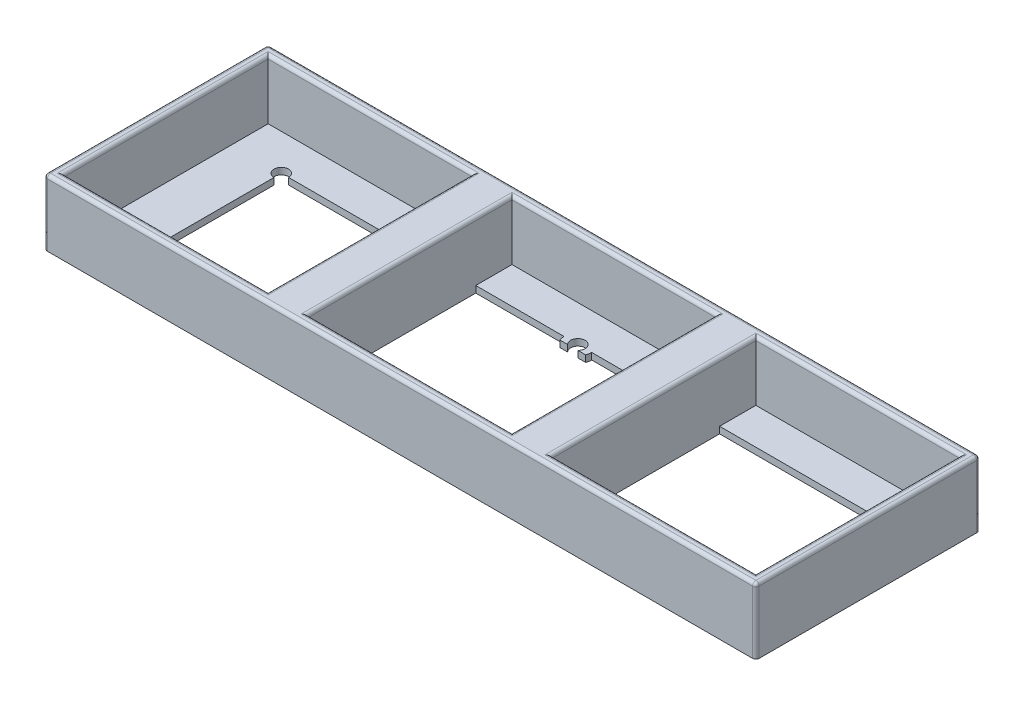
from build123d import *
from build123d.topology import SkipClean

# Parameters (mm, degrees)
EXTRUDE_1_DEPTH   = 1
EXTRUDE_1_2_DEPTH = 1
EXTRUDE_1_3_DEPTH = 1
EXTRUDE_1_4_DEPTH = 1
SKETCH_1_3_W      = 108
SKETCH_1_3_H      = 34
SKETCH_1_3_W_2    = 105
SKETCH_1_3_H_2    = 31
SKETCH_1_3_W_3    = 6
SKETCH_1_3_H_3    = 20
SKETCH_1_3_H_4    = 5.5
EXTRUDE_2_DEPTH   = 10
FILLET_1_R        = 0.5
FILLET_2_R        = 0.5
EXTRUDE_3_DEPTH   = 1
CHAMFER_1_SIZE    = 1


with BuildPart() as part:
    # 草图1 → 凸台-拉伸1 (new body)
    with BuildSketch(Plane(origin=(0, 0, 0), x_dir=(1, 0, 0), z_dir=(0, 1, 0))):
        with BuildLine():
            Line((-21.5, 10), (-21.5, 15.5))
            Line((-21.5, 15.5), (-52.5, 15.5))
            Line((-52.5, 15.5), (-52.5, -15.5))
            Line((-52.5, -15.5), (-21.5, -15.5))
            Line((-21.5, -15.5), (-21.5, -10))
            Line((-21.5, -10), (-43.9, -10))
            ThreePointArc((-43.9, -10), (-45.777817459, -10.777817459), (-45, -8.9))
            Line((-45, -8.9), (-45, 8.9))
            ThreePointArc((-45, 8.9), (-45.777817459, 10.777817459), (-43.9, 10))
            Line((-43.9, 10), (-21.5, 10))
        make_face()
    extrude(amount=EXTRUDE_1_DEPTH)


with BuildPart() as body_2:
    # 草图1 → Extrude 1 2 (new body)
    with BuildSketch(Plane(origin=(0, 0, 0), x_dir=(1, 0, 0), z_dir=(0, 1, 0))):
        with BuildLine():
            Line((-1.1, -10), (-15.5, -10))
            Line((-15.5, -10), (-15.5, -15.5))
            Line((-15.5, -15.5), (15.5, -15.5))
            Line((15.5, -15.5), (15.5, -10))
            Line((15.5, -10), (1.1, -10))
            ThreePointArc((1.1, -10), (0, -11.1), (-1.1, -10))
        make_face()
    extrude(amount=EXTRUDE_1_2_DEPTH)


with BuildPart() as body_3:
    # 草图1 → Extrude 1 3 (new body)
    with BuildSketch(Plane(origin=(0, 0, 0), x_dir=(1, 0, 0), z_dir=(0, 1, 0))):
        with BuildLine():
            Line((15.5, 15.5), (-15.5, 15.5))
            Line((-15.5, 15.5), (-15.5, 10))
            Line((-15.5, 10), (-1.1, 10))
            ThreePointArc((-1.1, 10), (0, 11.1), (1.1, 10))
            Line((1.1, 10), (15.5, 10))
            Line((15.5, 10), (15.5, 15.5))
        make_face()
    extrude(amount=EXTRUDE_1_3_DEPTH)


with BuildPart() as body_4:
    # 草图1 → Extrude 1 4 (new body)
    with BuildSketch(Plane(origin=(0, 0, 0), x_dir=(1, 0, 0), z_dir=(0, 1, 0))):
        with BuildLine():
            Line((52.5, 15.5), (21.5, 15.5))
            Line((21.5, 15.5), (21.5, 10))
            Line((21.5, 10), (43.9, 10))
            ThreePointArc((43.9, 10), (45, 11.1), (46.1, 10))
            ThreePointArc((46.1, 10), (45.777817459, 9.222182541), (45, 8.9))
            Line((45, 8.9), (45, -8.9))
            ThreePointArc((45, -8.9), (45.777817459, -9.222182541), (46.1, -10))
            ThreePointArc((46.1, -10), (45, -11.1), (43.9, -10))
            Line((43.9, -10), (21.5, -10))
            Line((21.5, -10), (21.5, -15.5))
            Line((21.5, -15.5), (52.5, -15.5))
            Line((52.5, -15.5), (52.5, 15.5))
        make_face()
    extrude(amount=EXTRUDE_1_4_DEPTH)

    # 草图1<3> → 凸台-拉伸2 (add)
    # profile 1 of 7: a face of its own
    with BuildSketch(Plane(origin=(0, 0, 0), x_dir=(1, 0, 0), z_dir=(0, 1, 0))):
        Rectangle(SKETCH_1_3_W, SKETCH_1_3_H)
        Rectangle(SKETCH_1_3_W_2, SKETCH_1_3_H_2, mode=Mode.SUBTRACT)
    # profile 2 of 7: a face of its own
    with BuildSketch(Plane(origin=(0, 0, 0), x_dir=(1, 0, 0), z_dir=(0, 1, 0))):
        with Locations((-18.5, 0)):
            Rectangle(SKETCH_1_3_W_3, SKETCH_1_3_H_3)
    # profile 3 of 7: a face of its own
    with BuildSketch(Plane(origin=(0, 0, 0), x_dir=(1, 0, 0), z_dir=(0, 1, 0))):
        with Locations((18.5, 0)):
            Rectangle(SKETCH_1_3_W_3, SKETCH_1_3_H_3)
    # profile 4 of 7: a face of its own
    with BuildSketch(Plane(origin=(0, 0, 0), x_dir=(1, 0, 0), z_dir=(0, 1, 0))):
        with Locations((-18.5, 12.75)):
            Rectangle(SKETCH_1_3_W_3, SKETCH_1_3_H_4)
    # profile 5 of 7: a face of its own
    with BuildSketch(Plane(origin=(0, 0, 0), x_dir=(1, 0, 0), z_dir=(0, 1, 0))):
        with Locations((-18.5, -12.75)):
            Rectangle(SKETCH_1_3_W_3, SKETCH_1_3_H_4)
    # profile 6 of 7: a face of its own
    with BuildSketch(Plane(origin=(0, 0, 0), x_dir=(1, 0, 0), z_dir=(0, 1, 0))):
        with Locations((18.5, 12.75)):
            Rectangle(SKETCH_1_3_W_3, SKETCH_1_3_H_4)
    # profile 7 of 7: a face of its own
    with BuildSketch(Plane(origin=(0, 0, 0), x_dir=(1, 0, 0), z_dir=(0, 1, 0))):
        with Locations((18.5, -12.75)):
            Rectangle(SKETCH_1_3_W_3, SKETCH_1_3_H_4)
    extrude(amount=EXTRUDE_2_DEPTH)

    # 圆角1
    fillet_1_edges = [body_4.edges().sort_by_distance(p)[0] for p in [
        (0, 10, -17),
        (54, 5, -17),
        (-54, 5, -17),
        (-54, 5, 17),
        (54, 10, 0),
        (54, 5, 17),
        (-54, 10, 0),
        (0, 10, 17),
    ]]
    fillet(fillet_1_edges, radius=FILLET_1_R)

    # 圆角2
    fillet_2_edges = [body_4.edges().sort_by_distance(p)[0] for p in [
        (21.5, 10, 0),
        (-37, 10, 15.5),
        (37, 10, 15.5),
        (-15.5, 10, 0),
        (-52.5, 10, 0),
        (0, 10, 15.5),
        (0, 10, -15.5),
        (15.5, 10, 0),
        (37, 10, -15.5),
        (52.5, 10, 0),
        (-37, 10, -15.5),
        (-21.5, 10, 0),
    ]]
    fillet(fillet_2_edges, radius=FILLET_2_R)


    with SkipClean():  # the faces are left unmerged after this step: merging them gives an invalid solid
        add(body_2.part)  # 凸台-拉伸3 merges body 2

        add(body_3.part)  # 凸台-拉伸3 merges body 3
        # 草图2 → 凸台-拉伸3 (add)
        with BuildSketch(Plane(origin=(0, 0, 0), x_dir=(1, 0, 0), z_dir=(0, 1, 0))):
            with BuildLine():
                ThreePointArc((2.1, 10), (1.940147018, 9.196364792), (1.48492424, 8.51507576))
                Line((1.48492424, 8.51507576), (0.777817459, 9.222182541))
                ThreePointArc((0.777817459, 9.222182541), (1.016267486, 9.579048224), (1.1, 10))
                Line((1.1, 10), (2.1, 10))
            make_face()
            with BuildLine():
                Line((-0.777817459, 9.222182541), (-1.48492424, 8.51507576))
                ThreePointArc((-1.48492424, 8.51507576), (-1.940147018, 9.196364792), (-2.1, 10))
                Line((-2.1, 10), (-1.1, 10))
                ThreePointArc((-1.1, 10), (-1.016267486, 9.579048224), (-0.777817459, 9.222182541))
            make_face()
            with BuildLine():
                Line((0.777817459, -9.222182541), (1.48492424, -8.51507576))
                ThreePointArc((1.48492424, -8.51507576), (1.940147018, -9.196364792), (2.1, -10))
                Line((2.1, -10), (1.1, -10))
                ThreePointArc((1.1, -10), (1.016267486, -9.579048224), (0.777817459, -9.222182541))
            make_face()
            with BuildLine():
                ThreePointArc((-2.1, -10), (-1.940147018, -9.196364792), (-1.48492424, -8.51507576))
                Line((-1.48492424, -8.51507576), (-0.777817459, -9.222182541))
                ThreePointArc((-0.777817459, -9.222182541), (-1.016267486, -9.579048224), (-1.1, -10))
                Line((-1.1, -10), (-2.1, -10))
            make_face()
        extrude(amount=EXTRUDE_3_DEPTH)

    # 倒角1
    # the kernel refuses this chamfer: 1 mm, written as the material it takes off along each edge
    with BuildSketch(Plane(origin=(-1.48492424, -2.571682988, 8.51507576), x_dir=(-0.5500408161449349, 0, 0.8351377734090429), z_dir=(0, 1, 0)), Plane(origin=(1.48492424, -2.571682988, -8.51507576), x_dir=(0.5500408161449349, 0, -0.8351377734090429), z_dir=(0, 1, 0))) as chamfer_1_piece_1:
        with BuildLine():
            Line((0.846694765, 0), (CHAMFER_1_SIZE * 0.201593991777, CHAMFER_1_SIZE * 0.979469173828))
            Line((CHAMFER_1_SIZE * 0.201593991777, CHAMFER_1_SIZE * 0.979469173828), (0, 0))
            ThreePointArc((0, 0), (0.434488163, -0.043085183), (0.846694765, 0))
        make_face()
    extrude(amount=6.143365976, mode=Mode.SUBTRACT)
    with BuildSketch(Plane(origin=(1.48492424, -2.571682988, 8.51507576), x_dir=(0.5500408161449355, 0, 0.8351377734090426), z_dir=(0, 1, 0)), Plane(origin=(-1.48492424, -2.571682988, -8.51507576), x_dir=(-0.5500408161449349, 0, -0.8351377734090429), z_dir=(0, 1, 0))) as chamfer_1_piece_2:
        with BuildLine():
            Line((0.846694765, 0), (CHAMFER_1_SIZE * 0.201593991777, -CHAMFER_1_SIZE * 0.979469173828))
            Line((CHAMFER_1_SIZE * 0.201593991777, -CHAMFER_1_SIZE * 0.979469173828), (0, 0))
            ThreePointArc((0, 0), (0.434488163, 0.043085183), (0.846694765, 0))
        make_face()
    extrude(amount=6.143365976, mode=Mode.SUBTRACT)


solid = Compound([part.part, body_4.part])
